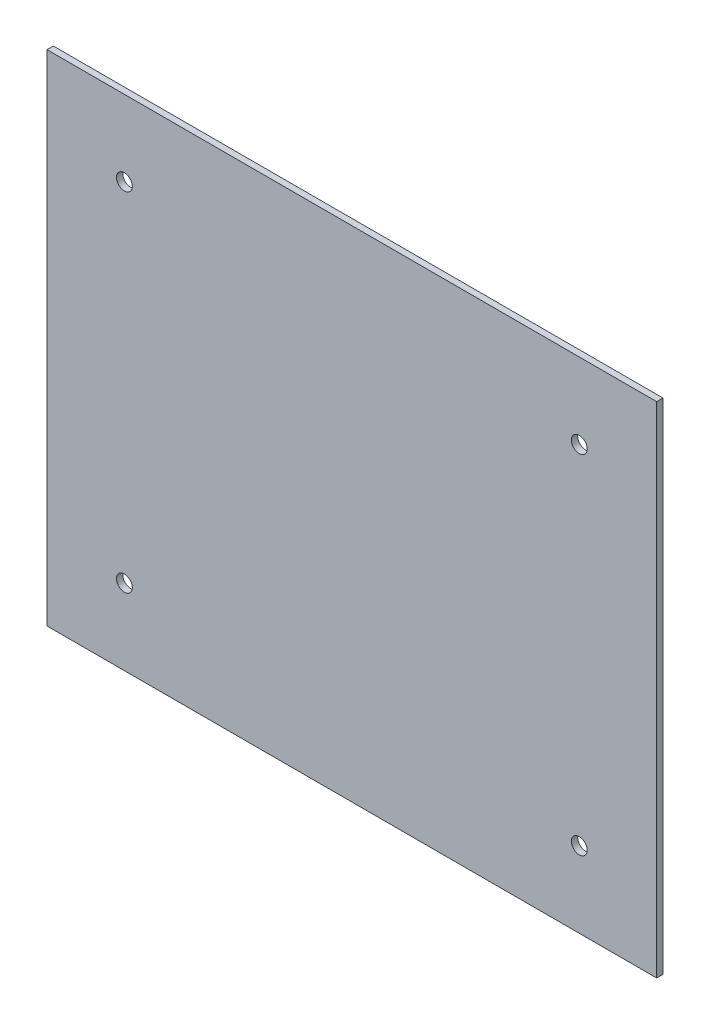
from build123d import *

# Parameters (mm, degrees)
SKETCH1_R             = 3
BOSS_EXTRUDE1_DEPTH   = 1
BOSS_EXTRUDE1_2_DEPTH = 1
BOSS_EXTRUDE1_3_DEPTH = 1
BOSS_EXTRUDE1_4_DEPTH = 1
SKETCH1_W             = 193
SKETCH1_H             = 158
BOSS_EXTRUDE1_5_DEPTH = 1
DELETEFACE1_START     = -1
DELETEFACE1_OUTLINE_R = 3
DELETEFACE1_DEPTH     = 2
SKETCH3_R             = 2.5
CUT_EXTRUDE2_DEPTH    = 384.236219583


with BuildPart() as part:
    # Sketch1 → Boss-Extrude1 (new, symmetric)
    with BuildSketch(Plane.XY):
        with Locations((-372, 55)):
            Circle(SKETCH1_R)
    extrude(amount=BOSS_EXTRUDE1_DEPTH, both=True)


with BuildPart() as body_2:
    # Sketch1 → Boss-Extrude1 2 (new, symmetric)
    with BuildSketch(Plane.XY):
        with Locations(Location((-372, -55, 0), (0, 0, 180))):
            Circle(SKETCH1_R)
    extrude(amount=BOSS_EXTRUDE1_2_DEPTH, both=True)


with BuildPart() as body_3:
    # Sketch1 → Boss-Extrude1 3 (new, symmetric)
    with BuildSketch(Plane.XY):
        with Locations((372, -55)):
            Circle(SKETCH1_R)
    extrude(amount=BOSS_EXTRUDE1_3_DEPTH, both=True)


with BuildPart() as body_4:
    # Sketch1 → Boss-Extrude1 4 (new, symmetric)
    with BuildSketch(Plane.XY):
        with Locations(Location((372, 55, 0), (0, 0, 180))):
            Circle(SKETCH1_R)
    extrude(amount=BOSS_EXTRUDE1_4_DEPTH, both=True)


with BuildPart() as body_5:
    # Sketch1 → Boss-Extrude1 5 (new, symmetric)
    with BuildSketch(Plane.XY):
        Rectangle(SKETCH1_W, SKETCH1_H)
        with Locations((0, 55)):
            Circle(SKETCH1_R, mode=Mode.SUBTRACT)
        with Locations(Location((0, -55, 0), (0, 0, 180))):
            Circle(SKETCH1_R, mode=Mode.SUBTRACT)
    extrude(amount=BOSS_EXTRUDE1_5_DEPTH, both=True)

    # DeleteFace1: read off the stored shape, not the designer's step
    # DeleteFace1 outline → DeleteFace1 (add)
    with BuildSketch(Plane.XY.offset(DELETEFACE1_START)):
        with Locations((0, 55)):
            Circle(DELETEFACE1_OUTLINE_R)
        with Locations((0, -55)):
            Circle(DELETEFACE1_OUTLINE_R)
    extrude(amount=DELETEFACE1_DEPTH)

    # Sketch3 → Cut-Extrude2 (cut, through all)
    with BuildSketch(Plane.XY.offset(1)):
        with Locations(Location((-72, 55, 0), (0, 0, 180))):
            Circle(SKETCH3_R)
        with Locations((72, -55)):
            Circle(SKETCH3_R)
        with Locations((72, 55)):
            Circle(SKETCH3_R)
        with Locations(Location((-72, -55, 0), (0, 0, 180))):
            Circle(SKETCH3_R)
    extrude(amount=-CUT_EXTRUDE2_DEPTH, mode=Mode.SUBTRACT)


solid = body_5.part
